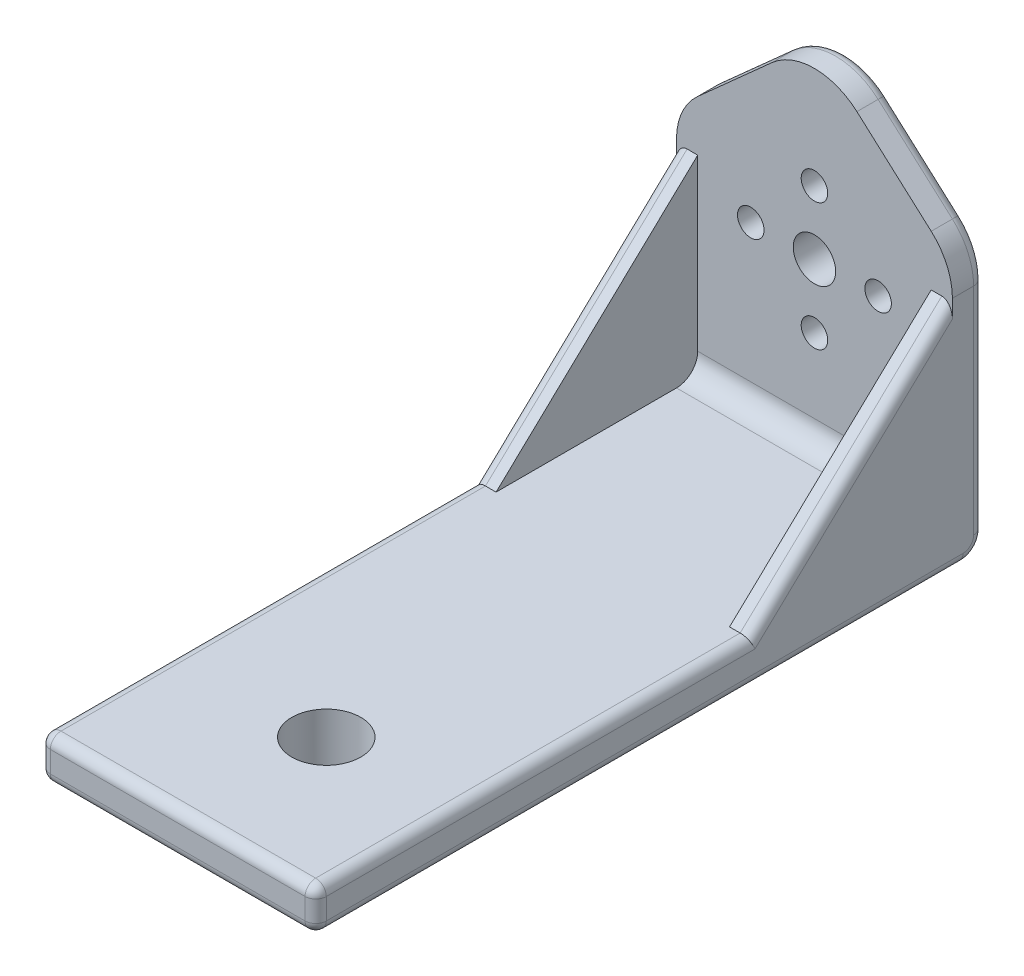
from build123d import *

# Parameters (mm, degrees)
SKETCH1_R           = 1.25
SKETCH1_R_2         = 2
BOSS_EXTRUDE1_DEPTH = 3
SKETCH2_W           = 26
SKETCH2_H           = 4
BOSS_EXTRUDE2_DEPTH = 60
SKETCH3_R           = 3.25
CUT_EXTRUDE1_DEPTH  = 72.226350639
SKETCH4_R           = 8
SKETCH4_R_2         = 3.25
BOSS_EXTRUDE3_DEPTH = 1
SKETCH5_R           = 1.5
BOSS_EXTRUDE4_DEPTH = 3
BOSS_EXTRUDE5_DEPTH = 2
FILLET1_R           = 2
FILLET2_R           = 1
FILLET3_R           = 0.5


with BuildPart() as part:
    # Sketch1 → Boss-Extrude1 (new body)
    with BuildSketch(Plane.XY):
        with BuildLine():
            Line((-13, -2.68256679), (-13, -25))
            Line((-13, -25), (13, -25))
            Line((13, -25), (13, -2.68256679))
            ThreePointArc((13, -2.68256679), (12.477468733, -0.233620837), (11.000887907, 1.788774838))
            Line((11.000887907, 1.788774838), (4.000887907, 8.052267471))
            ThreePointArc((4.000887907, 8.052267471), (0, 9.580925842), (-4.000887907, 8.052267471))
            Line((-4.000887907, 8.052267471), (-11.000887907, 1.788774838))
            ThreePointArc((-11.000887907, 1.788774838), (-12.477468733, -0.233620837), (-13, -2.68256679))
        make_face()
        Circle(SKETCH1_R, mode=Mode.SUBTRACT)
        with Locations((0, -6)):
            Circle(SKETCH1_R_2, mode=Mode.SUBTRACT)
        with Locations((6, -6)):
            Circle(SKETCH1_R, mode=Mode.SUBTRACT)
        with Locations((0, -12)):
            Circle(SKETCH1_R, mode=Mode.SUBTRACT)
        with Locations((-6, -6)):
            Circle(SKETCH1_R, mode=Mode.SUBTRACT)
    extrude(amount=BOSS_EXTRUDE1_DEPTH)

    # Sketch2 → Boss-Extrude2 (add)
    with BuildSketch(Plane.XY.offset(3)):
        with Locations((0, -23)):
            Rectangle(SKETCH2_W, SKETCH2_H)
    extrude(amount=BOSS_EXTRUDE2_DEPTH)

    # Sketch3 → Cut-Extrude1 (cut, through all)
    with BuildSketch(Plane(origin=(0, -21, 0), x_dir=(1, 0, 0), z_dir=(0, 1, 0))):
        with Locations((1, -50)):
            Circle(SKETCH3_R)
    extrude(amount=-CUT_EXTRUDE1_DEPTH, mode=Mode.SUBTRACT)

    # Sketch4 → Boss-Extrude3 (add)
    with BuildSketch(Plane.XZ.offset(25)):
        with Locations((1, 50)):
            Circle(SKETCH4_R)
        with Locations((1, 50)):
            Circle(SKETCH4_R_2, mode=Mode.SUBTRACT)
    extrude(amount=BOSS_EXTRUDE3_DEPTH)

    # Sketch5 → Boss-Extrude4 (add)
    with BuildSketch(Plane.XZ.offset(25)):
        with Locations((-7.5, 10)):
            Circle(SKETCH5_R)
        with Locations((7.5, 10)):
            Circle(SKETCH5_R)
    extrude(amount=BOSS_EXTRUDE4_DEPTH)

    # Sketch6 → Boss-Extrude5 (add)
    with BuildSketch(Plane.ZY.offset(13)):
        Polygon((0, -3), (3, -3), (22, -21), (22, -25), (0, -25), align=None)
    boss_extrude5 = extrude(amount=-BOSS_EXTRUDE5_DEPTH)

    # Mirror1: Boss-Extrude5 across plane
    add(boss_extrude5.mirror(Plane(origin=(0, 0, 0), x_dir=(0, 0, 1), z_dir=(1, 0, 0))))

    # Fillet1
    fillet1_edges = [part.edges().sort_by_distance(p)[0] for p in [
        (0, -21, 3),
        (0, -25, 0),
    ]]
    fillet(fillet1_edges, radius=FILLET1_R)

    # Fillet2
    fillet2_edges = [part.edges().sort_by_distance(p)[0] for p in [
        (13, -21, 42.5),
        (13, -25, 32.5),
        (13, -24.414213562, 0.585786438),
        (13, -12.841283395, 0),
        (12.477468733, -0.233620837, 0),
        (7.500887907, 4.920521155, 0),
        (0, 9.580925842, 0),
        (-7.500887907, 4.920521155, 0),
        (-12.477468733, -0.233620837, 0),
        (-13, -21, 42.5),
        (-13, -23, 63),
        (-13, -25, 32.5),
        (-13, -24.414213562, 0.585786438),
        (-13, -12.841283395, 0),
        (0, -21, 63),
        (13, -23, 63),
        (0, -25, 63),
        (13, -12, 12.5),
        (-13, -12, 12.5),
    ]]
    fillet(fillet2_edges, radius=FILLET2_R)

    # Fillet3
    fillet3_edges = [part.edges().sort_by_distance(p)[0] for p in [
        (6, -28, 10),
        (-9, -28, 10),
    ]]
    fillet(fillet3_edges, radius=FILLET3_R)


solid = part.part
